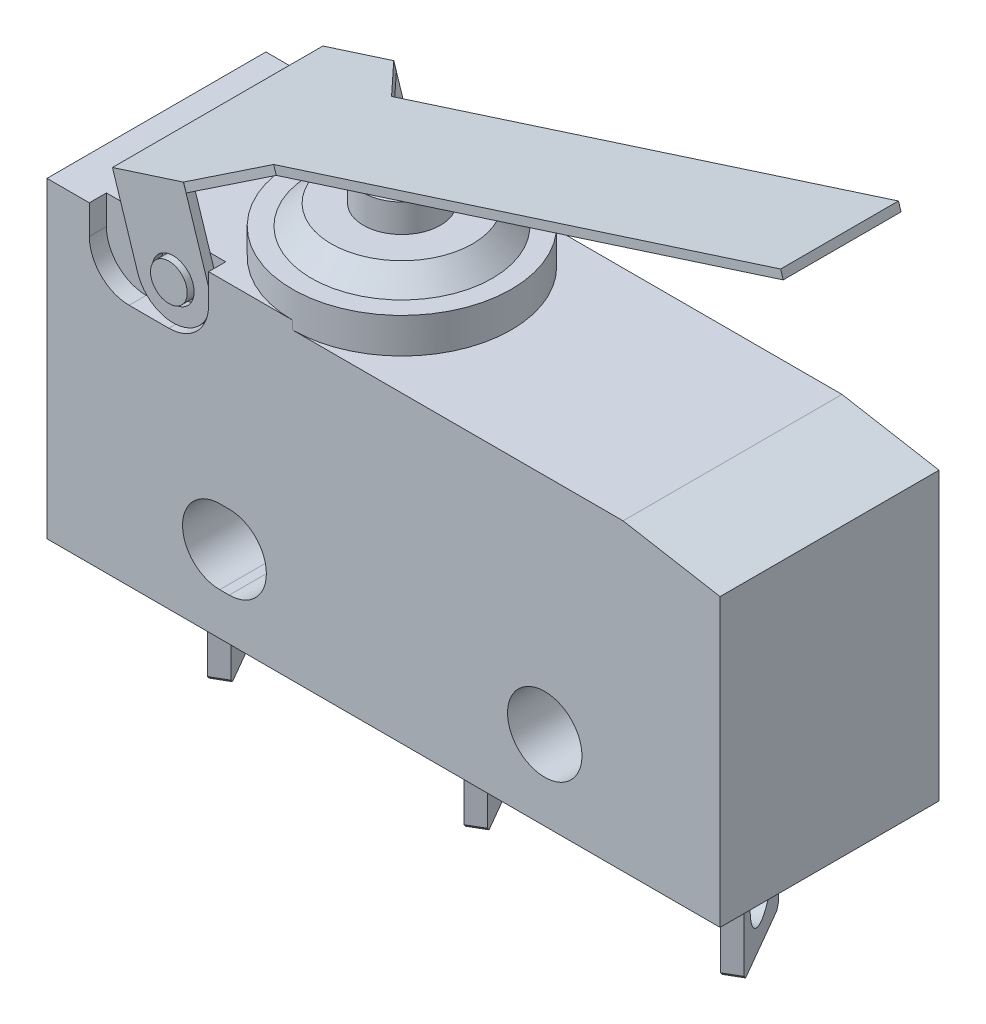
from build123d import *

# Parameters (mm, degrees)
SKETCH2_R          = 1.1049
EXTRUDE1_DEPTH     = 3.2512
SKETCH5_R          = 0.5461
CUT_EXTRUDE2_DEPTH = 0.508
SKETCH10_R         = 0.9017
EXTRUDE6_DEPTH     = 0.254
LPATTERN1_COUNT    = 3
LPATTERN1_PITCH    = 7.62
EXTRUDE3_DEPTH     = 1.75
EXTRUDE4_START     = -0.127
SKETCH8_R          = 0.6223
EXTRUDE4_DEPTH     = 0.254
EXTRUDE5_DEPTH     = 1.1202


with BuildPart() as part:
    # Sketch2 → Extrude1 (new, symmetric)
    with BuildSketch(Plane.XY):
        Polygon((9.9949, 8.509), (7.113888836, 9.017), (-2.7051, 9.017), (-2.7051, 9.271), (-9.9949, 9.271), (-9.9949, 0), (9.9949, 0), align=None)
        with Locations((4.7879, 2.3622)):
            Circle(SKETCH2_R, mode=Mode.SUBTRACT)
        with BuildLine():
            Line((-4.8641, 3.4671), (-4.5847, 3.4671))
            ThreePointArc((-4.5847, 3.4671), (-3.4798, 2.3622), (-4.5847, 1.2573))
            Line((-4.5847, 1.2573), (-4.8641, 1.2573))
            ThreePointArc((-4.8641, 1.2573), (-5.969, 2.3622), (-4.8641, 3.4671))
        make_face(mode=Mode.SUBTRACT)
    extrude(amount=EXTRUDE1_DEPTH, both=True)

    # Sketch11 → Revolve1 (revolve)
    with BuildSketch(Plane(origin=(0.218023231, -2.526963533, 0), x_dir=(1, 0, 0), z_dir=(0, 0, 1)), mode=Mode.PRIVATE) as revolve1_sk:
        with BuildLine():
            Line((-6.173123231, 11.543963533), (-6.173123231, 12.589163533))
            Line((-6.173123231, 12.589163533), (-5.611223993, 12.589163533))
            Line((-5.611223993, 12.589163533), (-5.020434283, 13.179953243))
            Line((-5.020434283, 13.179953243), (-4.066123231, 13.179953243))
            Line((-4.066123231, 13.179953243), (-4.066123231, 14.015456063))
            ThreePointArc((-4.066123231, 14.015456063), (-3.510548535, 14.218303252), (-2.923123231, 14.287163533))
            Line((-2.923123231, 14.287163533), (-2.923123231, 11.543963533))
            Line((-2.923123231, 11.543963533), (-6.173123231, 11.543963533))
        make_face()
    revolve(revolve1_sk.sketch.rotate(Axis((-2.7051, 11.7602, 0), (0, 1, 0)), 180), axis=Axis((-2.7051, 11.7602, 0), (0, 1, 0)))

    # Sketch5 → Cut-Extrude2 (cut)
    with BuildSketch(Plane.XY.offset(3.2512)):
        with BuildLine():
            Line((-8.7376, 9.271), (-8.7376, 8.4074))
            ThreePointArc((-8.7376, 8.4074), (-8.391663819, 7.572236181), (-7.5565, 7.2263))
            Line((-7.5565, 7.2263), (-6.3754, 7.2263))
            ThreePointArc((-6.3754, 7.2263), (-5.540236181, 7.572236181), (-5.1943, 8.4074))
            Line((-5.1943, 8.4074), (-5.1943, 9.271))
            Line((-5.1943, 9.271), (-8.7376, 9.271))
        make_face()
        with Locations((-6.3754, 8.4074)):
            Circle(SKETCH5_R, mode=Mode.SUBTRACT)
    cut_extrude2 = extrude(amount=-CUT_EXTRUDE2_DEPTH, mode=Mode.SUBTRACT)

    # Mirror1: Cut-Extrude2 across plane
    add(cut_extrude2.mirror(Plane.XY), mode=Mode.SUBTRACT)

    # Sketch10 → Extrude6 (add, symmetric)
    with BuildSketch(Plane(origin=(-7.58825, 0, 0.054992613), x_dir=(-0.500000000000001, 0, -0.8660254037844382), z_dir=(0.8660254037844382, 0, -0.500000000000001))):
        Polygon((-1.3335, 0), (-1.3335, -3.0734), (-1.2065, -3.2004), (1.3335, -3.2004), (1.4605, -3.0734), (1.4605, 0), align=None)
        with Locations((0.0635, -1.7018)):
            Circle(SKETCH10_R, mode=Mode.SUBTRACT)
    extrude6 = extrude(amount=EXTRUDE6_DEPTH, both=True)

    # LPattern1: Extrude6 ×3
    with Locations(*[(i * LPATTERN1_PITCH, 0, 0) for i in range(1, LPATTERN1_COUNT)]):
        add(extrude6)


with BuildPart() as body_2:
    # Sketch6 → Extrude3 (new, symmetric)
    with BuildSketch(Plane.XY):
        Polygon((-8.099837794, 10.154301357), (10.369675974, 16.090382655), (10.291956146, 16.3322), (-8.177557622, 10.396118702), align=None)
    extrude(amount=EXTRUDE3_DEPTH, both=True)


with BuildPart() as body_3:
    # Sketch8 → Extrude4 (new body)
    with BuildSketch(Plane.XY.offset(3.2512).offset(EXTRUDE4_START)):
        with BuildLine():
            Line((-5.3213, 8.746186574), (-6.069357622, 11.07369185))
            Line((-6.069357622, 11.07369185), (-8.177557622, 10.396118702))
            Line((-8.177557622, 10.396118702), (-7.4295, 8.068613426))
            ThreePointArc((-7.4295, 8.068613426), (-6.036613426, 7.3533), (-5.3213, 8.746186574))
        make_face()
        with Locations((-6.3754, 8.4074)):
            Circle(SKETCH8_R, mode=Mode.SUBTRACT)
    extrude(amount=-EXTRUDE4_DEPTH)

    # Sketch9 → Extrude5 (add)
    with BuildSketch(Plane.XY.offset(1.75)):
        Polygon((-5.991637794, 10.831874505), (-6.069357622, 11.07369185), (-8.177557622, 10.396118702), (-8.099837794, 10.154301357), align=None)
    extrude(amount=EXTRUDE5_DEPTH)


with BuildPart() as body_4:
    # Mirror7: mirrored copy
    add(body_3.part.mirror(Plane.XY))

    # Combine1: union body 2, body 3
    add(body_2.part)
    add(body_3.part)

    # Chamfer1
    # the kernel refuses this chamfer: 1.3716 mm, written as the material it adds along each edge
    with BuildSketch(Plane(origin=(-5.991637794, 10.831874505, -1.75), x_dir=(-0.026177086166058735, -0.008413286542090954, -0.9996219169112968), z_dir=(-0.3059835720550073, 0.9520367921632327, 0))) as chamfer1_piece_1_section:
        with BuildLine():
            Line((1.410928155, 0), (-0.077560078, -1.408794766))
            Line((-0.077560078, -1.408794766), (-0.104981706, -1.408040499))
            ThreePointArc((-0.104981706, -1.408040499), (-0.046811648, -0.704176463), (-0.027421628, 0.000754267))
            Line((-0.027421628, 0.000754267), (0.000754267, 0.027421628))
            ThreePointArc((0.000754267, 0.027421628), (0.705684997, 0.008031609), (1.411682421, 0.027421628))
            Line((1.411682421, 0.027421628), (1.410928155, 0))
        make_face()
    chamfer1_piece_1 = extrude(amount=0.254, mode=Mode.PRIVATE)
    chamfer1_piece_1 = split(chamfer1_piece_1, bisect_by=Plane(origin=(-5.982708869, 10.968142458, -2.8702), z_dir=(0, 0, -1)), keep=Keep.TOP, mode=Mode.PRIVATE)
    chamfer1_piece_1 = split(chamfer1_piece_1, bisect_by=Plane(origin=(-5.982708869, 10.968142458, -3.1242), z_dir=(0, 0, 1)), keep=Keep.TOP, mode=Mode.PRIVATE)
    add(chamfer1_piece_1)
    with BuildSketch(Plane(origin=(-4.912335703, 7.47373572, -1.75), x_dir=(-0.026177086166058915, -0.00841328654209101, -0.9996219169112968), z_dir=(-0.3059835720550073, 0.9520367921632327, 0))) as chamfer1_piece_2_section:
        with BuildLine():
            Line((1.410928155, 0), (-0.077560078, -1.408794766))
            Line((-0.077560078, -1.408794766), (-0.104981706, -1.408040499))
            ThreePointArc((-0.104981706, -1.408040499), (-0.046811648, -0.704176463), (-0.027421628, 0.000754267))
            Line((-0.027421628, 0.000754267), (0.000754267, 0.027421628))
            ThreePointArc((0.000754267, 0.027421628), (0.705684997, 0.008031609), (1.411682421, 0.027421628))
            Line((1.411682421, 0.027421628), (1.410928155, 0))
        make_face()
    chamfer1_piece_2 = extrude(amount=3.781320386, mode=Mode.PRIVATE)
    chamfer1_piece_2 = split(chamfer1_piece_2, bisect_by=Plane(origin=(-5.352514143, 8.736154383, -2.8702), z_dir=(0, 0, -1)), keep=Keep.TOP, mode=Mode.PRIVATE)
    chamfer1_piece_2 = split(chamfer1_piece_2, bisect_by=Plane(origin=(-5.352514143, 8.736154383, -3.1242), z_dir=(0, 0, 1)), keep=Keep.TOP, mode=Mode.PRIVATE)
    chamfer1_piece_2 = chamfer1_piece_2 & Plane(origin=(-6.3754, 8.4074, -3.007546716), x_dir=(-0.952036792163233, -0.3059835720550061, 0), z_dir=(0, 0, -1)) * Cylinder(1.107205109, 14, mode=Mode.PRIVATE)
    add(chamfer1_piece_2)
    with BuildSketch(Plane(origin=(-5.991637794, 10.831874505, -1.75), x_dir=(-0.026177086166058735, -0.008413286542090954, -0.9996219169112968), z_dir=(-0.3059835720550073, 0.9520367921632327, 0))) as chamfer1_piece_3_section:
        with BuildLine():
            Line((1.410928155, 0), (-0.077560078, -1.408794766))
            Line((-0.077560078, -1.408794766), (-0.104981706, -1.408040499))
            ThreePointArc((-0.104981706, -1.408040499), (-0.046811648, -0.704176463), (-0.027421628, 0.000754267))
            Line((-0.027421628, 0.000754267), (0.000754267, 0.027421628))
            ThreePointArc((0.000754267, 0.027421628), (0.705684997, 0.008031609), (1.411682421, 0.027421628))
            Line((1.411682421, 0.027421628), (1.410928155, 0))
        make_face()
    chamfer1_piece_3 = extrude(amount=0.254, mode=Mode.PRIVATE)
    chamfer1_piece_3 = split(chamfer1_piece_3, bisect_by=Plane(origin=(-5.581534864, 11.097079339, -2.8702), z_dir=(0, 0, 1)), keep=Keep.TOP, mode=Mode.PRIVATE)
    add(chamfer1_piece_3)
    with BuildSketch(Plane(origin=(-5.991637794, 10.831874505, 1.75), x_dir=(-0.026177086166058735, -0.008413286542090954, 0.9996219169112968), z_dir=(-0.3059835720550073, 0.9520367921632327, 0))) as chamfer1_piece_4_section:
        with BuildLine():
            Line((1.410928155, 0), (-0.077560078, 1.408794766))
            Line((-0.077560078, 1.408794766), (-0.104981706, 1.408040499))
            ThreePointArc((-0.104981706, 1.408040499), (-0.046811648, 0.704176463), (-0.027421628, -0.000754267))
            Line((-0.027421628, -0.000754267), (0.000754267, -0.027421628))
            ThreePointArc((0.000754267, -0.027421628), (0.705684997, -0.008031609), (1.411682421, -0.027421628))
            Line((1.411682421, -0.027421628), (1.410928155, 0))
        make_face()
    chamfer1_piece_4 = extrude(amount=0.254, mode=Mode.PRIVATE)
    chamfer1_piece_4 = split(chamfer1_piece_4, bisect_by=Plane(origin=(-5.982708869, 10.968142458, 2.8702), z_dir=(0, 0, 1)), keep=Keep.TOP, mode=Mode.PRIVATE)
    chamfer1_piece_4 = split(chamfer1_piece_4, bisect_by=Plane(origin=(-5.982708869, 10.968142458, 3.1242), z_dir=(0, 0, -1)), keep=Keep.TOP, mode=Mode.PRIVATE)
    add(chamfer1_piece_4)
    with BuildSketch(Plane(origin=(-4.912335703, 7.47373572, 1.75), x_dir=(-0.026177086166058915, -0.00841328654209101, 0.9996219169112968), z_dir=(-0.3059835720550073, 0.9520367921632327, 0))) as chamfer1_piece_5_section:
        with BuildLine():
            Line((1.410928155, 0), (-0.077560078, 1.408794766))
            Line((-0.077560078, 1.408794766), (-0.104981706, 1.408040499))
            ThreePointArc((-0.104981706, 1.408040499), (-0.046811648, 0.704176463), (-0.027421628, -0.000754267))
            Line((-0.027421628, -0.000754267), (0.000754267, -0.027421628))
            ThreePointArc((0.000754267, -0.027421628), (0.705684997, -0.008031609), (1.411682421, -0.027421628))
            Line((1.411682421, -0.027421628), (1.410928155, 0))
        make_face()
    chamfer1_piece_5 = extrude(amount=3.781320386, mode=Mode.PRIVATE)
    chamfer1_piece_5 = split(chamfer1_piece_5, bisect_by=Plane(origin=(-5.352514143, 8.736154383, 2.8702), z_dir=(0, 0, 1)), keep=Keep.TOP, mode=Mode.PRIVATE)
    chamfer1_piece_5 = chamfer1_piece_5 & Plane(origin=(-6.3754, 8.4074, 3.007546716), x_dir=(-0.952036792163233, -0.3059835720550061, 0), z_dir=(0, 0, 1)) * Cylinder(1.107205109, 14, mode=Mode.PRIVATE)
    chamfer1_piece_5 = split(chamfer1_piece_5, bisect_by=Plane(origin=(-5.352514143, 8.736154383, 3.1242), z_dir=(0, 0, -1)), keep=Keep.TOP, mode=Mode.PRIVATE)
    add(chamfer1_piece_5)
    with BuildSketch(Plane(origin=(-5.991637794, 10.831874505, 1.75), x_dir=(-0.026177086166058735, -0.008413286542090954, 0.9996219169112968), z_dir=(-0.3059835720550073, 0.9520367921632327, 0))) as chamfer1_piece_6_section:
        with BuildLine():
            Line((1.410928155, 0), (-0.077560078, 1.408794766))
            Line((-0.077560078, 1.408794766), (-0.104981706, 1.408040499))
            ThreePointArc((-0.104981706, 1.408040499), (-0.046811648, 0.704176463), (-0.027421628, -0.000754267))
            Line((-0.027421628, -0.000754267), (0.000754267, -0.027421628))
            ThreePointArc((0.000754267, -0.027421628), (0.705684997, -0.008031609), (1.411682421, -0.027421628))
            Line((1.411682421, -0.027421628), (1.410928155, 0))
        make_face()
    chamfer1_piece_6 = extrude(amount=0.254, mode=Mode.PRIVATE)
    chamfer1_piece_6 = split(chamfer1_piece_6, bisect_by=Plane(origin=(-5.581534864, 11.097079339, 2.8702), z_dir=(0, 0, -1)), keep=Keep.TOP, mode=Mode.PRIVATE)
    add(chamfer1_piece_6)


solid = Compound([part.part, body_4.part])
